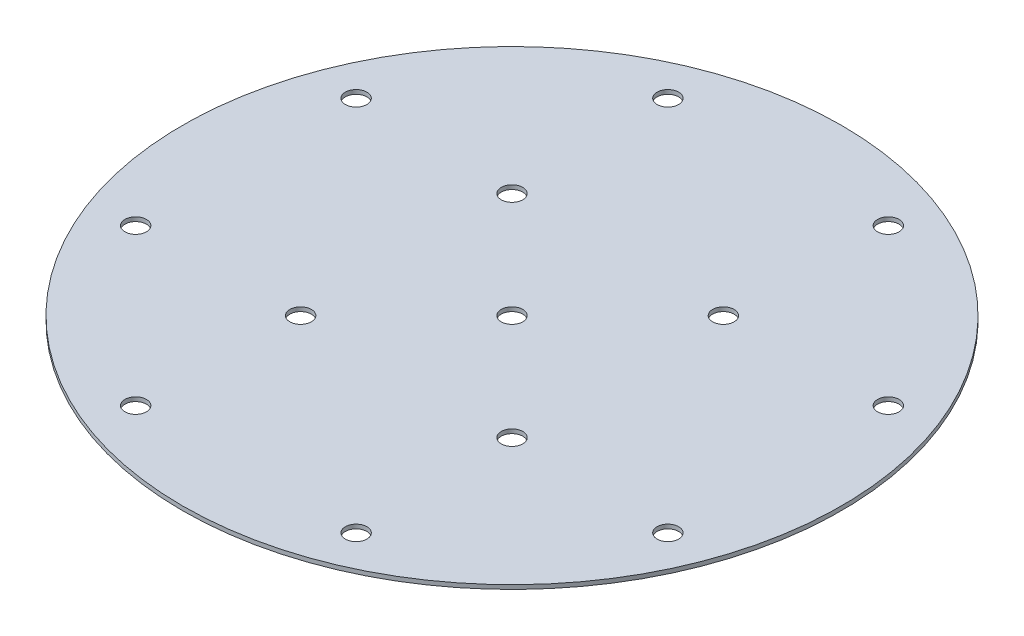
from build123d import *

# Parameters (mm, degrees)
SKETCH2_W                  = 79.375
SKETCH2_H                  = 1
F_6_0_204_DIAMETER_HOLE1_D = 5.1816
CIRPATTERN3_COUNT          = 4
F_6_0_204_DIAMETER_HOLE2_D = 5.1816


with BuildPart() as part:
    # Sketch2 → Revolve1 (revolve)
    with BuildSketch(Plane(origin=(0, 0, 0), x_dir=(0, 0, -1), z_dir=(1, 0, 0))):
        with Locations((-39.6875, 0.5)):
            Rectangle(SKETCH2_W, SKETCH2_H)
    revolve(axis=Axis((0, -0.05, 0), (0, 1, 0)))

    # #6 (0.204) Diameter Hole1 (through all)
    with Locations(Plane(origin=(0, 1, 0), x_dir=(1, 0, 0), z_dir=(0, 1, 0))):
        with Locations((-26.54866312, 64.094142568), (264.743675233, 73.787758551), (-64.094142568, 26.54866312), (-25.455844123, 25.455844123)):
            f_6_0_204_diameter_hole1 = Hole(F_6_0_204_DIAMETER_HOLE1_D / 2)

    # CirPattern3: #6 (0.204) Diameter Hole1 ×4 about axis
    cirpattern3_axis = Axis((0, -0.05, 0), (0, 1, 0))
    for i in range(1, CIRPATTERN3_COUNT):
        add(f_6_0_204_diameter_hole1.rotate(cirpattern3_axis, i * 360 / CIRPATTERN3_COUNT), mode=Mode.SUBTRACT)

    # #6 (0.204) Diameter Hole2 (through all)
    with Locations(Plane(origin=(0, 1, 0), x_dir=(1, 0, 0), z_dir=(0, 1, 0))):
        with Locations((0, 0)):
            Hole(F_6_0_204_DIAMETER_HOLE2_D / 2)


solid = part.part
